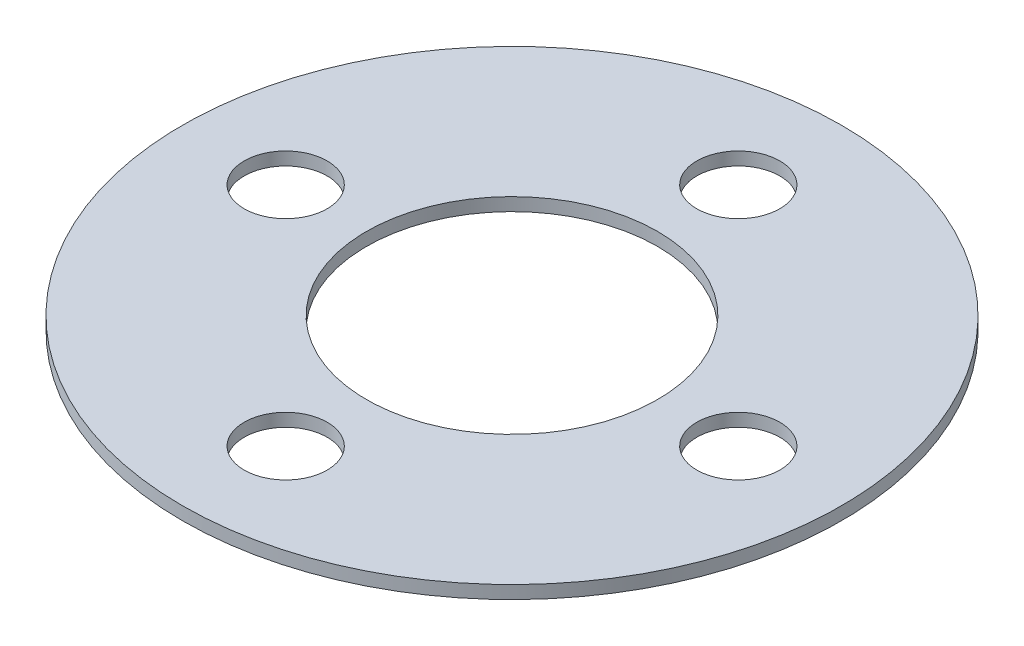
from build123d import *

# Parameters (mm, degrees)
SKETCH1_R           = 21.844
SKETCH1_R_2         = 2.75
BOSS_EXTRUDE1_DEPTH = 0.8636
SKETCH2_R           = 9.652
CUT_EXTRUDE1_DEPTH  = 0.8636


with BuildPart() as part:
    # Sketch1 → Boss-Extrude1 (new body)
    with BuildSketch(Plane(origin=(0, 0, 0), x_dir=(1, 0, 0), z_dir=(0, 1, 0))):
        Circle(SKETCH1_R)
        with Locations((0, 15)):
            Circle(SKETCH1_R_2, mode=Mode.SUBTRACT)
        with Locations((15, 0)):
            Circle(SKETCH1_R_2, mode=Mode.SUBTRACT)
        with Locations((0, -15)):
            Circle(SKETCH1_R_2, mode=Mode.SUBTRACT)
        with Locations((-15, 0)):
            Circle(SKETCH1_R_2, mode=Mode.SUBTRACT)
    extrude(amount=BOSS_EXTRUDE1_DEPTH)

    # Sketch2 → Cut-Extrude1 (cut)
    with BuildSketch(Plane.XZ):
        Circle(SKETCH2_R)
    extrude(amount=-CUT_EXTRUDE1_DEPTH, mode=Mode.SUBTRACT)


solid = part.part
